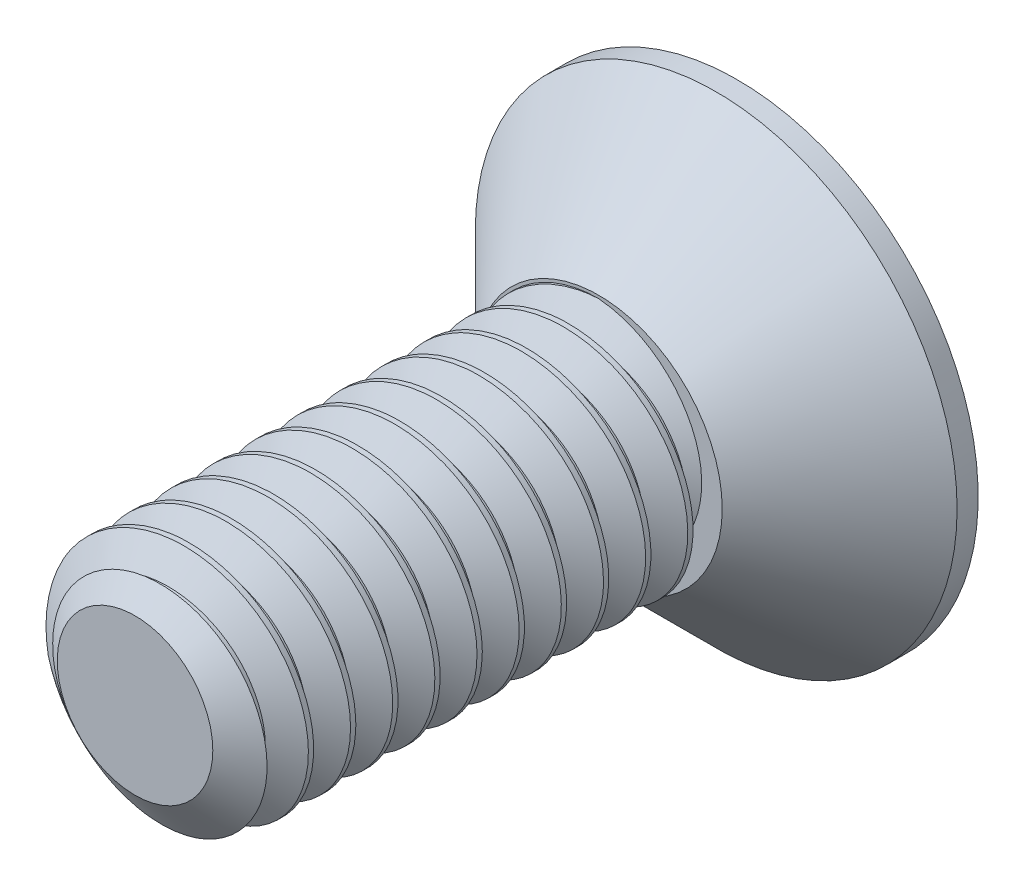
from build123d import *

# Parameters (mm, degrees)
SKETCH1_R          = 2
EXTRUDE1_DEPTH     = 10
CUT_SWEEP1_PITCH   = 0.7
SKETCH6_R          = 4
EXTRUDE2_DEPTH     = 2.3
CUT_EXTRUDE1_DEPTH = 1.875
SKETCH8_R          = 1.443375673
CUT_EXTRUDE2_DEPTH = 12.48912538
CUT_EXTRUDE2_TAPER = 45


with BuildPart() as part:
    # Sketch1 → Extrude1 (new body)
    with BuildSketch(Plane.XY):
        Circle(SKETCH1_R)
    extrude(amount=-EXTRUDE1_DEPTH)

    # Cut-Sweep1: the profile of Sketch3 profile screwed along a right-hand helix of 15.285714 turns, 6 arcs to a turn; built about Z, then put on its axis
    cut_sweep1_z = Axis((0, 0, 0), (0, 0, 1))
    cut_sweep1_corners = [(2.0003, 0, -0.612673205), (1.545336663, 0, -0.35), (1.545336663, 0, -0.2625), (2.0003, 0, 0.000173205)]
    with BuildLine(mode=Mode.PRIVATE) as cut_sweep1_profile:
        Line(cut_sweep1_corners[0], cut_sweep1_corners[1])
        Line(cut_sweep1_corners[1], cut_sweep1_corners[2])
        Line(cut_sweep1_corners[2], cut_sweep1_corners[3])
        Line(cut_sweep1_corners[3], cut_sweep1_corners[0])
    cut_sweep1_cap = Face(cut_sweep1_profile.wire())
    cut_sweep1_turn_angles = [0, 30, 60, 90, 120, 150, 180, 210, 240, 270, 300, 330, 360]
    cut_sweep1_turn_weights = [1, 0.8660254037844387, 1, 0.8660254037844387, 1, 0.8660254037844387, 1, 0.8660254037844387, 1, 0.8660254037844387, 1, 0.8660254037844387, 1]
    cut_sweep1_turn_rails = [Edge.make_bspline([Vector(p[0], p[1], 0).rotate(cut_sweep1_z, cut_sweep1_turn_angles[k]) / cut_sweep1_turn_weights[k] + Vector(0, 0, p[2] + CUT_SWEEP1_PITCH * cut_sweep1_turn_angles[k] / 360) for k in range(13)], [0, 0, 0, 1, 1, 2, 2, 3, 3, 4, 4, 5, 5, 6, 6, 6], 2, cut_sweep1_turn_weights) for p in cut_sweep1_corners]
    cut_sweep1_turn_sides = [Face.make_surface_from_curves(cut_sweep1_turn_rails[p[0]], cut_sweep1_turn_rails[p[1]]) for p in [(0, 1), (1, 2), (2, 3), (3, 0)]]
    cut_sweep1_last_angles = [5400, 5430, 5460, 5481.428571429, 5502.857142857]
    cut_sweep1_last_weights = [1, 0.8660254037844387, 1, 0.9308737486442353, 1]
    cut_sweep1_last_rails = [Edge.make_bspline([Vector(p[0], p[1], 0).rotate(cut_sweep1_z, cut_sweep1_last_angles[k]) / cut_sweep1_last_weights[k] + Vector(0, 0, p[2] + CUT_SWEEP1_PITCH * cut_sweep1_last_angles[k] / 360) for k in range(5)], [0, 0, 0, 1, 1, 2, 2, 2], 2, cut_sweep1_last_weights) for p in cut_sweep1_corners]
    cut_sweep1_last_sides = [Face.make_surface_from_curves(cut_sweep1_last_rails[p[0]], cut_sweep1_last_rails[p[1]]) for p in [(0, 1), (1, 2), (2, 3), (3, 0)]]
    cut_sweep1 = Plane(origin=(0, 0, 0), x_dir=(0, 1, 0), z_dir=(0, 0, -1)) * Solid(Shell([*[p.moved(Location((0, 0, CUT_SWEEP1_PITCH * i))) for i in range(15) for p in cut_sweep1_turn_sides], *cut_sweep1_last_sides, cut_sweep1_cap, cut_sweep1_cap.rotate(cut_sweep1_z, 5502.857142857).moved(Location((0, 0, CUT_SWEEP1_PITCH * 5502.857142857 / 360)))]))
    add(cut_sweep1, mode=Mode.SUBTRACT)

    # Sketch4 → Cut-Revolve1 (revolve, cut)
    with BuildSketch(Plane(origin=(0, 0, 0), x_dir=(0, 0, -1), z_dir=(1, 0, 0)), mode=Mode.PRIVATE) as cut_revolve1_sk:
        Polygon((0.496211411, 2), (0, 1.291336663), (0, 2), align=None)
    revolve(cut_revolve1_sk.sketch.rotate(Axis((0, 0, 0), (0, 0, -1)), 271.401126896), axis=Axis((0, 0, 0), (0, 0, -1)), mode=Mode.SUBTRACT)

    # Sketch6 → Extrude2 (add)
    with BuildSketch(Plane(origin=(0, 0, -10), x_dir=(-1, 0, 0), z_dir=(0, 0, -1))):
        Circle(SKETCH6_R)
    extrude(amount=-EXTRUDE2_DEPTH)

    # Sketch10 → Cut-Revolve2 (revolve, cut)
    with BuildSketch(Plane(origin=(0, 0, 0), x_dir=(0, 0, -1), z_dir=(1, 0, 0)), mode=Mode.PRIVATE) as cut_revolve2_sk:
        Polygon((9.65, -4), (7.7, -2.05), (7.7, -4), align=None)
    revolve(cut_revolve2_sk.sketch.rotate(Axis((0, 0, 0), (0, 0, -1)), 270), axis=Axis((0, 0, 0), (0, 0, -1)), mode=Mode.SUBTRACT)

    # Sketch7 → Cut-Extrude1 (cut)
    with BuildSketch(Plane.XY.offset(-10)):
        Polygon((0, 1.443375673), (-1.25, 0.721687836), (-1.25, -0.721687836), (0, -1.443375673), (1.25, -0.721687836), (1.25, 0.721687836), align=None)
    extrude(amount=CUT_EXTRUDE1_DEPTH, mode=Mode.SUBTRACT)

    # Sketch8 → Cut-Extrude2 (cut, through all)
    with BuildSketch(Plane.XY.offset(-10)):
        Circle(SKETCH8_R)
    extrude(amount=CUT_EXTRUDE2_DEPTH, taper=CUT_EXTRUDE2_TAPER, mode=Mode.SUBTRACT)


solid = part.part
